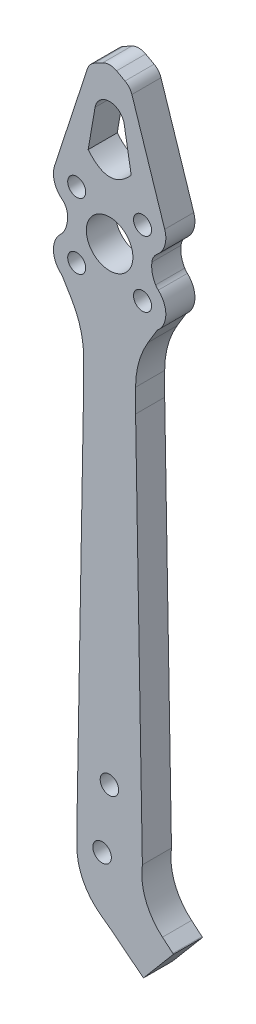
from build123d import *

# Parameters (mm, degrees)
CROQUIS1_R              = 1.59
CROQUIS1_R_2            = 1.5875
CROQUIS1_R_3            = 4
SALIENTE_EXTRUIR1_DEPTH = 5


with BuildPart() as part:
    # Croquis1 → Saliente-Extruir1 (new body)
    with BuildSketch(Plane.XY):
        with BuildLine():
            ThreePointArc((1.193677036, 26.351337281), (0.615813463, 26.577686227), (0, 26.654718258))
            ThreePointArc((0, 26.654718258), (-0.615813463, 26.577686227), (-1.193677036, 26.351337281))
            Line((-1.193677036, 26.351337281), (-2.643396871, 25.563536913))
            ThreePointArc((-2.643396871, 25.563536913), (-3.37085174, 24.966684186), (-3.826144074, 24.143196083))
            Line((-3.826144074, 24.143196083), (-9.459133033, 6.898899359))
            ThreePointArc((-9.459133033, 6.898899359), (-9.492428214, 4.521789334), (-8.170864273, 2.54562401))
            ThreePointArc((-8.170864273, 2.54562401), (-7.560847643, 1.822599507), (-7.263149059, 0.924679537))
            ThreePointArc((-7.263149059, 0.924679537), (-7.323699332, -0.668363985), (-7.905472696, -2.152612532))
            ThreePointArc((-7.905472696, -2.152612532), (-8.1122929, -2.44647205), (-8.359106022, -2.707644973))
            ThreePointArc((-8.359106022, -2.707644973), (-9.655003955, -5.778505112), (-8.174803271, -8.764897481))
            Line((-8.174803271, -8.764897481), (-6.609038667, -11.365635857))
            ThreePointArc((-6.609038667, -11.365635857), (-5.007106824, -15.087530614), (-4.459817284, -19.102398031))
            Line((-4.459817284, -19.102398031), (-4.459817284, -23.092828176))
            Line((-4.459817284, -23.092828176), (-5.626230736, -89.592828176))
            Line((-5.626230736, -89.592828176), (-5.626230736, -92.551487387))
            ThreePointArc((-5.626230736, -92.551487387), (-4.556587953, -97.05134516), (-1.57648674, -100.588554855))
            Line((-1.57648674, -100.588554855), (0.378725822, -102.036099663))
            Line((0.378725822, -102.036099663), (5.712458635, -106.264975888))
            Line((5.712458635, -106.264975888), (5.810595875, -106.347754))
            Line((5.810595875, -106.347754), (10.968990992, -100.231756111))
            Line((10.968990992, -100.231756111), (10.870509433, -100.149870658))
            Line((10.870509433, -100.149870658), (9.079798936, -98.639418203))
            ThreePointArc((9.079798936, -98.639418203), (6.184977491, -94.562025637), (5.626230736, -89.592828176))
            Line((5.626230736, -89.592828176), (4.459817284, -23.092828176))
            Line((4.459817284, -23.092828176), (4.459817284, -19.102398031))
            ThreePointArc((4.459817284, -19.102398031), (5.007106824, -15.087530614), (6.609038667, -11.365635857))
            Line((6.609038667, -11.365635857), (8.174803271, -8.764897481))
            ThreePointArc((8.174803271, -8.764897481), (9.655003955, -5.778505112), (8.359106022, -2.707644973))
            ThreePointArc((8.359106022, -2.707644973), (8.1122929, -2.44647205), (7.905472696, -2.152612532))
            ThreePointArc((7.905472696, -2.152612532), (7.323699332, -0.668363985), (7.263149059, 0.924679537))
            ThreePointArc((7.263149059, 0.924679537), (7.560847643, 1.822599507), (8.170864273, 2.54562401))
            ThreePointArc((8.170864273, 2.54562401), (9.492428214, 4.521789334), (9.459133033, 6.898899359))
            Line((9.459133033, 6.898899359), (3.826144074, 24.143196083))
            ThreePointArc((3.826144074, 24.143196083), (3.37085174, 24.966684186), (2.643396871, 25.563536913))
            Line((2.643396871, 25.563536913), (1.193677036, 26.351337281))
        make_face()
        with Locations((-1.294069753, -91.189423743)):
            Circle(CROQUIS1_R, mode=Mode.SUBTRACT)
        with Locations((-0.033781964, -80.518355704)):
            Circle(CROQUIS1_R_2, mode=Mode.SUBTRACT)
        with BuildLine():
            ThreePointArc((-6.64153821, -4.459817284), (-4.994947964, -4.255290812), (-4.106854249, -5.656854249))
            ThreePointArc((-4.106854249, -5.656854249), (-4.197760816, -6.179870838), (-4.459817284, -6.64153821))
            ThreePointArc((-4.459817284, -6.64153821), (-6.75286976, -6.75286976), (-6.64153821, -4.459817284))
        make_face(mode=Mode.SUBTRACT)
        with BuildLine():
            ThreePointArc((-4.459817284, 6.64153821), (-4.197760816, 6.179870838), (-4.106854249, 5.656854249))
            ThreePointArc((-4.106854249, 5.656854249), (-4.994947964, 4.255290812), (-6.64153821, 4.459817284))
            ThreePointArc((-6.64153821, 4.459817284), (-6.75286976, 6.75286976), (-4.459817284, 6.64153821))
        make_face(mode=Mode.SUBTRACT)
        Circle(CROQUIS1_R_3, mode=Mode.SUBTRACT)
        with BuildLine():
            add(Edge.make_bspline(
                [(-3.690213899, 12.181248638), (-1.857382168, 9.98527581), (0, 9.968932167)],
                knots=[0, 0, 0, 0.502108549, 0.502108549, 0.502108549], degree=2))
            Line((-3.690213899, 12.181248638), (-2.502144822, 19.079689902))
            ThreePointArc((-2.502144822, 19.079689902), (-1.635896096, 20.590481825), (0, 21.187744795))
            ThreePointArc((0, 21.187744795), (1.635896096, 20.590481825), (2.502144822, 19.079689902))
            Line((2.502144822, 19.079689902), (3.707704632, 12.079689902))
            add(Edge.make_bspline(
                [(0, 9.968932167), (1.841782426, 9.95272579), (3.707704632, 12.079689902)],
                knots=[0.502108549, 0.502108549, 0.502108549, 1, 1, 1], degree=2))
        make_face(mode=Mode.SUBTRACT)
        with BuildLine():
            ThreePointArc((6.64153821, -4.459817284), (7.058417687, -4.994947964), (7.206854249, -5.656854249))
            ThreePointArc((7.206854249, -5.656854249), (6.179870838, -7.115947683), (4.459817284, -6.64153821))
            ThreePointArc((4.459817284, -6.64153821), (4.560838739, -4.560838739), (6.64153821, -4.459817284))
        make_face(mode=Mode.SUBTRACT)
        with BuildLine():
            ThreePointArc((4.459817284, 6.64153821), (6.179870838, 7.115947683), (7.206854249, 5.656854249))
            ThreePointArc((7.206854249, 5.656854249), (7.058417687, 4.994947964), (6.64153821, 4.459817284))
            ThreePointArc((6.64153821, 4.459817284), (4.560838739, 4.560838739), (4.459817284, 6.64153821))
        make_face(mode=Mode.SUBTRACT)
    extrude(amount=SALIENTE_EXTRUIR1_DEPTH)


solid = part.part
